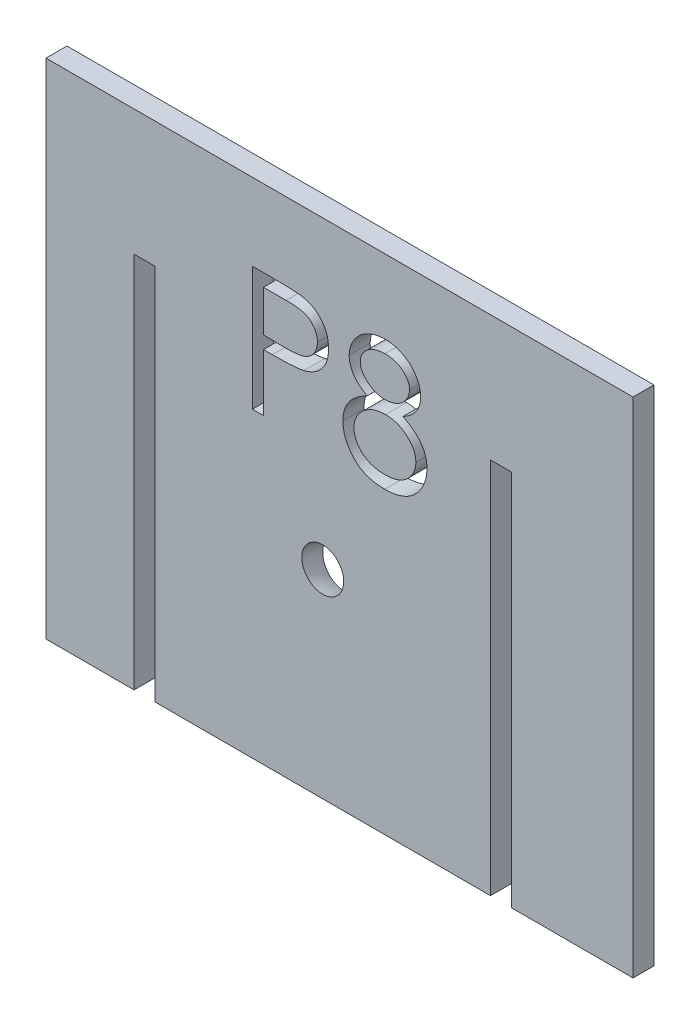
from build123d import *

# Parameters (mm, degrees)
BOSS_EXTRUDE1_DEPTH = 6.35
CUT_EXTRUDE1_DEPTH  = 1287.13369896
CAVITY2_OUTLINE_R   = 12.7


# Read off the part's stored shape, not the designer's step: Cavity2
with BuildPart() as part:
    # Sketch1 → Boss-Extrude1 (new, symmetric)
    with BuildSketch(Plane.XY):
        Polygon((798.4, 381), (1001.6, 381), (1001.6, 609.6), (1014.3, 609.6), (1014.3, 381), (1087.96, 381), (1087.96, 685.8), (732.36, 685.8), (732.36, 381), (785.7, 381), (785.7, 609.6), (798.4, 609.6), align=None)
    extrude(amount=BOSS_EXTRUDE1_DEPTH, both=True)

    # Sketch2 → Cut-Extrude1 (cut, through all)
    # profile 1 of 2: a face of its own
    with BuildSketch(Plane.XY.offset(6.35)):
        with BuildLine():
            Line((857.36, 639.129868283), (872.068533654, 639.129868283))
            add(Edge.make_bspline(
                [(872.068533654, 639.129868283), (873.080195928, 639.128756221), (875.018585774, 639.12662546), (877.798194111, 639.062023764), (880.32268836, 638.975737505), (882.586625094, 638.856125508), (884.596970053, 638.714770002), (886.344626472, 638.516512016), (887.843331251, 638.309505682), (888.741326596, 638.099046971), (889.150865385, 638.003065399)],
                knots=[0, 0, 0, 0, 1.415646017, 2.712440637, 3.8905458, 4.950247383, 5.884950622, 6.709939814, 7.411656543, 8, 8, 8, 8], degree=3))
            add(Edge.make_bspline(
                [(889.150865385, 638.003065399), (889.669298251, 637.861166474), (890.693947763, 637.580712294), (892.170398687, 637.018989648), (893.575123947, 636.352943252), (894.912943057, 635.593858826), (896.167416265, 634.709168165), (897.35726, 633.734733499), (898.471973864, 632.64805703), (899.505289404, 631.46132689), (900.454249352, 630.19446525), (901.271313982, 628.828560324), (901.955468847, 627.386603822), (902.542253236, 625.869598725), (902.96457726, 624.264806079), (903.282725111, 622.583376528), (903.484659989, 620.82549031), (903.504000598, 619.624207434), (903.513846154, 619.012680783)],
                knots=[0, 0, 0, 0, 0.999701418, 1.975846123, 2.934577507, 3.890451536, 4.834027766, 5.787354733, 6.749476667, 7.726910423, 8.712836071, 9.690891519, 10.682875813, 11.679750201, 12.712814741, 13.765529915, 14.8625177, 16, 16, 16, 16], degree=3))
            add(Edge.make_bspline(
                [(903.513846154, 619.012680783), (903.504815624, 618.396014138), (903.487146782, 617.189464196), (903.275083525, 615.424333021), (902.989436562, 613.737510375), (902.550214012, 612.132736436), (901.974949589, 610.619541355), (901.300119885, 609.174800669), (900.486187091, 607.823093414), (899.55094074, 606.559512323), (898.510549432, 605.382871345), (897.369415043, 604.301697178), (896.132144489, 603.322318497), (894.802669888, 602.442539704), (893.36803027, 601.682762286), (891.849984122, 601.002248609), (890.235336627, 600.430725881), (889.117997042, 600.130081708), (888.549903846, 599.977224052)],
                knots=[0, 0, 0, 0, 1.121902311, 2.195077645, 3.232258892, 4.234102512, 5.217864754, 6.176164875, 7.132989551, 8.084763148, 9.034132444, 9.988522005, 10.94243251, 11.903244335, 12.886203696, 13.894208494, 14.929344452, 16, 16, 16, 16], degree=3))
            add(Edge.make_bspline(
                [(888.549903846, 599.977224052), (888.080032403, 599.877303029), (887.050281817, 599.658320298), (885.354366342, 599.413853365), (883.379822358, 599.205190493), (881.129344931, 599.048737545), (878.604954111, 598.914801078), (875.805284311, 598.808341923), (872.7248398, 598.749845055), (870.576170284, 598.746828067), (869.454350962, 598.745252899)],
                knots=[0, 0, 0, 0, 0.601384939, 1.31797006, 2.144135048, 3.087295005, 4.142315834, 5.309527816, 6.595305764, 8, 8, 8, 8], degree=3))
            Line((869.454350962, 598.745252899), (864.090769231, 598.745252899))
            Line((864.090769231, 598.745252899), (864.090769231, 564.129868283))
            Line((864.090769231, 564.129868283), (857.36, 564.129868283))
            Line((857.36, 564.129868283), (857.36, 639.129868283))
        make_face()
        with BuildLine():
            Line((864.090769231, 631.437560591), (864.090769231, 606.437560591))
            Line((864.090769231, 606.437560591), (877.221778846, 606.272296168))
            add(Edge.make_bspline(
                [(877.221778846, 606.272296168), (877.862920114, 606.271964805), (879.100630112, 606.271325116), (880.888549181, 606.356722762), (882.547319624, 606.455305605), (884.071846239, 606.599646822), (885.462816263, 606.803673768), (886.722549025, 607.009639581), (887.841276516, 607.307611636), (889.150545125, 607.708820261), (890.609473999, 608.393090596), (892.196635753, 609.386302526), (893.541719747, 610.652317702), (894.705683249, 612.07577123), (895.629380633, 613.659324004), (896.305580468, 615.353658362), (896.702890983, 617.141397995), (896.756166562, 618.364715256), (896.783076923, 618.982632706)],
                knots=[0, 0, 0, 0, 1.160613943, 2.240541288, 3.23993089, 4.169200891, 5.011653406, 5.7853311, 6.478053781, 7.106038997, 8.262395093, 9.384106736, 10.481365981, 11.59014053, 12.70357646, 13.786202915, 14.881775077, 16, 16, 16, 16], degree=3))
            add(Edge.make_bspline(
                [(896.783076923, 618.982632706), (896.756020212, 619.585600852), (896.70223482, 620.784226898), (896.302466324, 622.540914625), (895.630695313, 624.217394005), (894.699482573, 625.781102977), (893.569315503, 627.19943449), (892.25575815, 628.431515784), (890.76190255, 629.421980843), (889.3722976, 630.06126545), (888.13798647, 630.45159278), (887.065873044, 630.724696505), (885.855358591, 630.94274521), (884.50604903, 631.119305984), (883.02840259, 631.270451582), (881.409724413, 631.373008237), (879.656146344, 631.433039442), (878.438776968, 631.436017054), (877.807716346, 631.437560591)],
                knots=[0, 0, 0, 0, 1.120700087, 2.227813068, 3.331159281, 4.466773991, 5.599788987, 6.693661531, 7.80175334, 8.91857717, 9.525282508, 10.207424825, 10.974604443, 11.810962634, 12.737642355, 13.736264703, 14.826523623, 16, 16, 16, 16], degree=3))
            Line((877.807716346, 631.437560591), (864.090769231, 631.437560591))
        make_face(mode=Mode.SUBTRACT)
    # profile 2 of 2: a face of its own
    with BuildSketch(Plane.XY.offset(6.35)):
        with BuildLine():
            add(Edge.make_bspline(
                [(948.631033654, 605.911719245), (949.244931093, 605.591620188), (950.44223612, 604.967320126), (952.14746201, 603.962088104), (953.705854894, 602.902638857), (955.160652647, 601.839013298), (956.486295878, 600.730477911), (957.667961868, 599.572624564), (958.734839438, 598.394354308), (959.665413381, 597.175714876), (960.483917025, 595.919943824), (961.191319922, 594.623745116), (961.795974268, 593.289959392), (962.275180098, 591.904027322), (962.669932777, 590.486307429), (962.941552885, 589.018493532), (963.087629696, 587.510257656), (963.115247126, 586.490936906), (963.129230769, 585.974820206)],
                knots=[0, 0, 0, 0, 1.272397273, 2.481599622, 3.635517121, 4.734568067, 5.792894095, 6.808321871, 7.773003508, 8.711915296, 9.623354172, 10.525449501, 11.423591555, 12.311487226, 13.218079475, 14.126165749, 15.051214107, 16, 16, 16, 16], degree=3))
            add(Edge.make_bspline(
                [(963.129230769, 585.974820206), (963.112700329, 585.252725936), (963.079980386, 583.823430433), (962.794980728, 581.713870901), (962.368274046, 579.665047002), (961.74514164, 577.677407914), (960.93699755, 575.761921342), (959.941065351, 573.916947625), (958.813682383, 572.112248143), (957.908277258, 571.001832394), (957.450144231, 570.439964437)],
                knots=[0, 0, 0, 0, 1.025265484, 2.029385089, 3.018602448, 3.995076438, 4.983346944, 5.966715145, 6.97116228, 8, 8, 8, 8], degree=3))
            add(Edge.make_bspline(
                [(957.450144231, 570.439964437), (956.853648353, 569.784383562), (955.668027662, 568.481323005), (953.636964927, 566.789519934), (951.40792456, 565.367747203), (948.989531718, 564.209063749), (946.388250973, 563.307223915), (943.604636589, 562.659169959), (940.633261883, 562.287975048), (938.591001788, 562.234318125), (937.543293269, 562.20679136)],
                knots=[0, 0, 0, 0, 0.954267603, 1.896743057, 2.838368354, 3.796610408, 4.779680527, 5.799409237, 6.871065594, 8, 8, 8, 8], degree=3))
            add(Edge.make_bspline(
                [(937.543293269, 562.20679136), (936.535863513, 562.231487316), (934.575507535, 562.279543139), (931.722124445, 562.605138101), (929.062344377, 563.175735244), (926.580702199, 563.956691158), (924.29215877, 564.972624622), (922.203235173, 566.237090524), (920.283792911, 567.699192856), (918.592082763, 569.400923103), (917.090187538, 571.223591796), (915.770872115, 573.103983433), (914.674284718, 575.042269666), (913.74584696, 577.009548963), (913.035103617, 579.033395123), (912.542841967, 581.103395404), (912.230213809, 583.21593418), (912.188618061, 584.641612464), (912.167692308, 585.358834629)],
                knots=[0, 0, 0, 0, 1.256902934, 2.445805442, 3.576955095, 4.645999104, 5.686449165, 6.692658513, 7.68621702, 8.689161843, 9.678783111, 10.630372946, 11.551080876, 12.453998257, 13.34127905, 14.221779781, 15.105423033, 16, 16, 16, 16], degree=3))
            add(Edge.make_bspline(
                [(912.167692308, 585.358834629), (912.180075473, 585.88510303), (912.204548977, 586.925195142), (912.373938582, 588.461823605), (912.646262753, 589.957455065), (913.016108256, 591.417613858), (913.517344537, 592.831669697), (914.122533104, 594.206322705), (914.8282178, 595.543124825), (915.644242766, 596.849386562), (916.593571852, 598.106804681), (917.668507204, 599.336718852), (918.890532961, 600.520044576), (920.246054223, 601.671239396), (921.719580069, 602.810724549), (923.349384294, 603.876918733), (925.092261461, 604.945303693), (926.330948724, 605.584053523), (926.966370192, 605.911719245)],
                knots=[0, 0, 0, 0, 0.941657376, 1.861047343, 2.762797495, 3.66048619, 4.553285746, 5.444104102, 6.34607688, 7.256116206, 8.197091036, 9.162375105, 10.176350973, 11.237807142, 12.343728897, 13.50695164, 14.721116704, 16, 16, 16, 16], degree=3))
            add(Edge.make_bspline(
                [(926.966370192, 605.911719245), (926.096555021, 606.386035715), (924.412349388, 607.304445163), (922.182289935, 608.991876722), (920.266776575, 610.819472754), (918.718461198, 612.8258255), (917.499770596, 614.948258521), (916.663657642, 617.1734925), (916.098018699, 619.460266361), (916.041986688, 621.022542002), (916.013846154, 621.807151937)],
                knots=[0, 0, 0, 0, 1.166880483, 2.259407225, 3.286803203, 4.280235371, 5.237608625, 6.161067461, 7.076446754, 8, 8, 8, 8], degree=3))
            add(Edge.make_bspline(
                [(916.013846154, 621.807151937), (916.048890956, 622.606385331), (916.11933712, 624.212983836), (916.688979704, 626.604543621), (917.617266843, 628.953470015), (918.879859636, 631.248378147), (920.45244284, 633.411597032), (922.339154536, 635.351760167), (924.494939468, 637.051291934), (926.909036618, 638.477924208), (929.506955955, 639.63900261), (932.248007181, 640.439968813), (935.084432035, 640.963599886), (937.015097449, 641.022885342), (937.994014423, 641.052945206)],
                knots=[0, 0, 0, 0, 0.888701115, 1.786444228, 2.72001202, 3.692817113, 4.693886446, 5.687152267, 6.695133018, 7.739871481, 8.800368666, 9.853104506, 10.91144658, 12, 12, 12, 12], degree=3))
            add(Edge.make_bspline(
                [(937.994014423, 641.052945206), (938.947667601, 641.02195214), (940.828163026, 640.960837343), (943.592333617, 640.451118527), (946.237152419, 639.599771676), (948.753498825, 638.444831176), (951.096324556, 637.022253873), (953.16637404, 635.299378), (954.994929368, 633.367773342), (956.507452102, 631.205210413), (957.753799733, 628.91912055), (958.621676185, 626.527209388), (959.177789913, 624.081158126), (959.247933431, 622.426058043), (959.283076923, 621.596815399)],
                knots=[0, 0, 0, 0, 1.072916533, 2.115669174, 3.151510826, 4.193348718, 5.225979165, 6.227137561, 7.216255879, 8.211077061, 9.189680878, 10.138522389, 11.067357538, 12, 12, 12, 12], degree=3))
            add(Edge.make_bspline(
                [(959.283076923, 621.596815399), (959.252336338, 620.783029745), (959.191963576, 619.184800973), (958.684107729, 616.854946963), (957.828822438, 614.673046129), (956.661090374, 612.614340011), (955.139115642, 610.716165062), (953.28321422, 608.954383564), (951.108182543, 607.314522957), (949.474020695, 606.389100865), (948.631033654, 605.911719245)],
                knots=[0, 0, 0, 0, 0.975232327, 1.915300861, 2.843280834, 3.77672583, 4.742871857, 5.749627742, 6.839139064, 8, 8, 8, 8], degree=3))
        make_face()
        with BuildLine():
            add(Edge.make_bspline(
                [(937.618413462, 633.360637514), (937.092324764, 633.346678073), (936.06306524, 633.319367304), (934.55387943, 633.176682226), (933.118757273, 632.899113295), (931.742704402, 632.529712333), (930.444586997, 632.030684015), (929.206775114, 631.443648103), (928.050335332, 630.729946699), (926.961307411, 629.929349601), (925.980933672, 629.048787328), (925.110836136, 628.131350497), (924.388090832, 627.159020667), (923.774352772, 626.155984388), (923.32903454, 625.092472039), (922.995513743, 624.001089688), (922.770055354, 622.868045743), (922.753161282, 622.093691946), (922.744615385, 621.701983668)],
                knots=[0, 0, 0, 0, 1.203892937, 2.355340988, 3.463153438, 4.544400666, 5.610487187, 6.640501085, 7.674077295, 8.714426146, 9.728707835, 10.68524104, 11.601827946, 12.495867327, 13.368432065, 14.231010473, 15.105153427, 16, 16, 16, 16], degree=3))
            add(Edge.make_bspline(
                [(922.744615385, 621.701983668), (922.759344676, 621.310258464), (922.788451871, 620.536153186), (923.013561757, 619.393027486), (923.349065788, 618.269706699), (923.877294247, 617.192901462), (924.510859069, 616.125258051), (925.29281927, 615.093459779), (926.22472701, 614.093915818), (927.275315016, 613.135127792), (928.41984797, 612.237297154), (929.632363182, 611.457871837), (930.897642997, 610.805712326), (932.202687337, 610.262939367), (933.560796924, 609.841012138), (934.963649927, 609.541684), (936.41148212, 609.355641211), (937.392494565, 609.333419327), (937.888846154, 609.322175976)],
                knots=[0, 0, 0, 0, 0.873023192, 1.725219244, 2.590779336, 3.480155217, 4.391973325, 5.357036234, 6.360879153, 7.436073238, 8.526419356, 9.601555421, 10.645666583, 11.697338044, 12.750135903, 13.812665442, 14.89329948, 16, 16, 16, 16], degree=3))
            add(Edge.make_bspline(
                [(937.888846154, 609.322175976), (938.526348378, 609.340880272), (939.795056256, 609.378104122), (941.665327647, 609.724200703), (943.483812885, 610.268613224), (945.231075123, 611.013469645), (946.861887663, 611.948352356), (948.315603411, 613.067631316), (949.579822543, 614.34546197), (950.641407048, 615.761951308), (951.464475186, 617.269485342), (952.10522821, 618.782348759), (952.47939711, 620.316682281), (952.528202117, 621.344545791), (952.552307692, 621.852224052)],
                knots=[0, 0, 0, 0, 1.076279235, 2.141928126, 3.20205304, 4.278698113, 5.344010996, 6.36967002, 7.368914609, 8.37248503, 9.349703398, 10.264243087, 11.142681841, 12, 12, 12, 12], degree=3))
            add(Edge.make_bspline(
                [(952.552307692, 621.852224052), (952.540909887, 622.208539108), (952.518286877, 622.915773421), (952.331857107, 623.960166964), (952.023803542, 624.980800897), (951.606737541, 625.986106697), (951.057956224, 626.961979528), (950.407295064, 627.923759985), (949.616912891, 628.849812067), (948.729846461, 629.761716678), (947.723873419, 630.605660042), (946.600932441, 631.347832404), (945.366780648, 631.978097187), (944.021388862, 632.489999075), (942.569711917, 632.874477996), (941.018436036, 633.162399734), (939.354626459, 633.324680694), (938.209703222, 633.348391955), (937.618413462, 633.360637514)],
                knots=[0, 0, 0, 0, 0.814439003, 1.616544685, 2.417341072, 3.248991801, 4.09997495, 4.973547432, 5.9003056, 6.880240646, 7.880314356, 8.896779544, 9.951930927, 11.043077905, 12.18215768, 13.381699519, 14.647792085, 16, 16, 16, 16], degree=3))
        make_face(mode=Mode.SUBTRACT)
        with BuildLine():
            add(Edge.make_bspline(
                [(938.054110577, 601.629868283), (937.387129458, 601.61800454), (936.078675248, 601.594730769), (934.161741073, 601.335670046), (932.322030384, 600.975040195), (930.565746031, 600.427950799), (928.893629672, 599.716597436), (927.296629331, 598.860857294), (925.786962269, 597.849312083), (924.385475275, 596.694813179), (923.105689643, 595.450682023), (921.98286893, 594.13363627), (921.029350634, 592.768153424), (920.261495258, 591.336891368), (919.631243857, 589.87015685), (919.217375058, 588.331422666), (918.952052667, 586.75027024), (918.916424849, 585.675410988), (918.898461538, 585.133474052)],
                knots=[0, 0, 0, 0, 1.140299081, 2.23698856, 3.303958914, 4.344563908, 5.37730929, 6.408454204, 7.439741482, 8.480804886, 9.510774543, 10.48932336, 11.43758569, 12.353841022, 13.263987381, 14.161954604, 15.073269652, 16, 16, 16, 16], degree=3))
            add(Edge.make_bspline(
                [(918.898461538, 585.133474052), (918.927674227, 584.459954635), (918.985631517, 583.123707849), (919.445416634, 581.148784893), (920.183320966, 579.236905147), (921.212432737, 577.403649017), (922.486737863, 575.690432453), (924.053733605, 574.197101547), (925.816037271, 572.870212721), (927.833277001, 571.797058433), (930.03674413, 570.940025824), (932.425852607, 570.34954091), (934.966315151, 569.958652698), (936.720449271, 569.919263102), (937.618413462, 569.899099052)],
                knots=[0, 0, 0, 0, 0.898778495, 1.783155532, 2.693654817, 3.627872908, 4.583023416, 5.533784346, 6.509005473, 7.520592997, 8.575161974, 9.658835044, 10.801527049, 12, 12, 12, 12], degree=3))
            add(Edge.make_bspline(
                [(937.618413462, 569.899099052), (938.32020706, 569.912573519), (939.687526037, 569.938826099), (941.682224943, 570.170560977), (943.564608127, 570.538052935), (945.331025236, 571.072557488), (947.001250374, 571.725056986), (948.546965104, 572.564458732), (950.007933542, 573.519151369), (951.312164743, 574.651826152), (952.500019216, 575.862101039), (953.535732627, 577.143316249), (954.43482301, 578.460651227), (955.140486347, 579.843875899), (955.704620357, 581.26645264), (956.1101251, 582.74149931), (956.360329713, 584.273540016), (956.385634621, 585.312805825), (956.398461538, 585.83960386)],
                knots=[0, 0, 0, 0, 1.224942928, 2.386581632, 3.501229538, 4.569074225, 5.605009692, 6.626002462, 7.634866581, 8.645888296, 9.63523824, 10.59253846, 11.518950513, 12.414518923, 13.29783783, 14.186679152, 15.080837789, 16, 16, 16, 16], degree=3))
            add(Edge.make_bspline(
                [(956.398461538, 585.83960386), (956.379050498, 586.351261158), (956.340775318, 587.360159972), (956.097846217, 588.855156973), (955.671077422, 590.299502992), (955.085490346, 591.710574547), (954.305898289, 593.059780634), (953.387793932, 594.38227002), (952.280062818, 595.641336689), (951.028364329, 596.846760175), (949.664243742, 597.961383105), (948.214233495, 598.947406789), (946.689495023, 599.777809281), (945.093254789, 600.453162753), (943.429057162, 600.984322817), (941.698126193, 601.355379856), (939.898435305, 601.588942774), (938.675830932, 601.616072328), (938.054110577, 601.629868283)],
                knots=[0, 0, 0, 0, 0.917430815, 1.809013306, 2.70690318, 3.612392954, 4.541220862, 5.495268465, 6.494511384, 7.542276156, 8.608045339, 9.649016899, 10.681629292, 11.715607085, 12.752076957, 13.808767841, 14.885711793, 16, 16, 16, 16], degree=3))
        make_face(mode=Mode.SUBTRACT)
    extrude(amount=-CUT_EXTRUDE1_DEPTH, mode=Mode.SUBTRACT)


with BuildPart() as cut_extrude1_piece_1:
    # of the separate pieces the step leaves, piece 1, a body of its own (cut_extrude1_pieces)
    add(part.part.solids().sort_by_distance((798.4, 381, -6.35))[0])

    # Cavity2 outline → Cavity2 (revolve, cut)
    with BuildSketch(Plane(origin=(0, 420.499546279, 23.05), x_dir=(0, 1, 0), z_dir=(0, 0, -1))):
        with Locations((82.55, 900)):
            Circle(CAVITY2_OUTLINE_R)
    revolve(axis=Axis((0, 420.499546279, 23.05), (1, 0, 0)), mode=Mode.SUBTRACT)


with BuildPart() as cut_extrude1_piece_2:
    # of the separate pieces the step leaves, piece 2, a body of its own (cut_extrude1_pieces)
    add(part.part.solids().sort_by_distance((918.898461538, 585.133474052, -6.35))[0])


with BuildPart() as cut_extrude1_piece_3:
    # of the separate pieces the step leaves, piece 3, a body of its own (cut_extrude1_pieces)
    add(part.part.solids().sort_by_distance((877.807716346, 631.437560591, -6.35))[0])


with BuildPart() as cut_extrude1_piece_4:
    # of the separate pieces the step leaves, piece 4, a body of its own (cut_extrude1_pieces)
    add(part.part.solids().sort_by_distance((922.744615385, 621.701983668, -6.35))[0])


solid = Compound([cut_extrude1_piece_1.part, cut_extrude1_piece_2.part, cut_extrude1_piece_3.part, cut_extrude1_piece_4.part])
